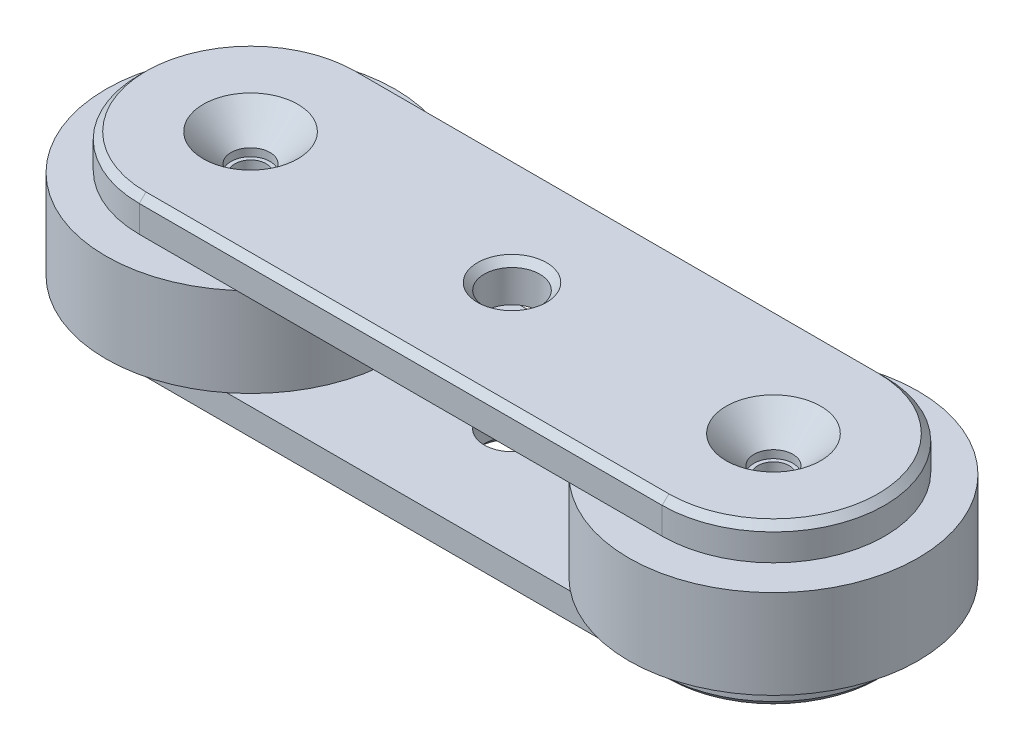
from build123d import *
from build123d.topology import SkipClean

# Parameters (mm, degrees)
SKETCH1_R            = 2.5
BOSS_EXTRUDE1_DEPTH  = 3
SKETCH10_R           = 7.5
BOSS_EXTRUDE6_DEPTH  = 0.2
SKETCH11_R           = 4.95
BOSS_EXTRUDE8_DEPTH  = 8
SKETCH12_R           = 13
SKETCH12_R_2         = 5
BOSS_EXTRUDE9_DEPTH  = 8
SKETCH13_R           = 1.4
CUT_EXTRUDE6_DEPTH   = 41.332245164
SKETCH14_R           = 2.5
SKETCH14_R_2         = 1.75
BOSS_EXTRUDE10_DEPTH = 3
BOSS_EXTRUDE11_START = 0.2
SKETCH15_R           = 7.5
SKETCH15_R_2         = 1.75
BOSS_EXTRUDE11_DEPTH = 0.2
CHAMFER1_SIZE        = 2.5
CHAMFER2_SIZE        = 0.6
BOSS_EXTRUDE12_DEPTH = 0.5
BOSS_EXTRUDE13_START = 0.5
BOSS_EXTRUDE13_DEPTH = 0.5
CHAMFER3_SIZE        = 0.6


with BuildPart() as part:
    # Sketch1 → Boss-Extrude1 (new body)
    with BuildSketch(Plane(origin=(0, 0, 0), x_dir=(1, 0, 0), z_dir=(0, 1, 0))):
        with BuildLine():
            Line((23.5, -10), (-23.5, -10))
            ThreePointArc((-23.5, -10), (-33.5, 0), (-23.5, 10))
            Line((-23.5, 10), (23.5, 10))
            ThreePointArc((23.5, 10), (33.5, 0), (23.5, -10))
        make_face()
        Circle(SKETCH1_R, mode=Mode.SUBTRACT)
    extrude(amount=BOSS_EXTRUDE1_DEPTH)

    # Sketch10 → Boss-Extrude6 (add)
    with BuildSketch(Plane(origin=(0, 3, 0), x_dir=(1, 0, 0), z_dir=(0, 1, 0))):
        with Locations((-23.5, 0)):
            Circle(SKETCH10_R)
        with Locations((23.5, 0)):
            Circle(SKETCH10_R)
    extrude(amount=BOSS_EXTRUDE6_DEPTH)

    # Sketch11 → Boss-Extrude8 (add)
    with BuildSketch(Plane(origin=(0, 3.2, 0), x_dir=(1, 0, 0), z_dir=(0, 1, 0))):
        with Locations((-23.5, 0)):
            Circle(SKETCH11_R)
        with Locations((23.5, 0)):
            Circle(SKETCH11_R)
    extrude(amount=BOSS_EXTRUDE8_DEPTH)

    # Sketch13 → Cut-Extrude6 (cut, through all)
    with BuildSketch(Plane(origin=(0, 11.2, 0), x_dir=(1, 0, 0), z_dir=(0, 1, 0))):
        with Locations((-23.5, 0)):
            Circle(SKETCH13_R)
        with Locations((23.5, 0)):
            Circle(SKETCH13_R)
    extrude(amount=-CUT_EXTRUDE6_DEPTH, mode=Mode.SUBTRACT)

    # Sketch16 → Boss-Extrude12 (add)
    with SkipClean():  # the faces are left unmerged after this step: merging them gives an invalid solid
        with BuildSketch(Plane(origin=(0, 3, 0), x_dir=(1, 0, 0), z_dir=(0, 1, 0))):
            with BuildLine():
                Line((-10, 0), (-2.5, 0))
                ThreePointArc((-2.5, 0), (0, 2.5), (2.5, 0))
                Line((2.5, 0), (10, 0))
                ThreePointArc((10, 0), (0, 10), (-10, 0))
            make_face()
        extrude(amount=BOSS_EXTRUDE12_DEPTH)

    # Chamfer3
    chamfer3_edges = [part.edges().sort_by_distance(p)[0] for p in [
        (22.1, 0, 0),
        (-2.5, 0, 0),
        (-24.9, 0, 0),
        (33.5, 0, 0),
        (0, 0, -10),
        (0, 0, 10),
        (-33.5, 0, 0),
    ]]
    chamfer(chamfer3_edges, length=CHAMFER3_SIZE)


with BuildPart() as body_2:
    # Sketch12 → Boss-Extrude9 (new body)
    with BuildSketch(Plane(origin=(0, 3.2, 0), x_dir=(1, 0, 0), z_dir=(0, 1, 0))):
        with Locations((-23.5, 0)):
            Circle(SKETCH12_R)
        with Locations((-23.5, 0)):
            Circle(SKETCH12_R_2, mode=Mode.SUBTRACT)
    extrude(amount=BOSS_EXTRUDE9_DEPTH)


with BuildPart() as body_3:
    # Mirror3: mirrored copy
    add(body_2.part.mirror(Plane(origin=(0, 0, 0), x_dir=(0, 0, 1), z_dir=(1, 0, 0))))


with BuildPart() as body_4:
    # Sketch14 → Boss-Extrude10 (new body)
    with BuildSketch(Plane(origin=(0, 11.4, 0), x_dir=(1, 0, 0), z_dir=(0, 1, 0))):
        with BuildLine():
            Line((-23.5, -10), (23.5, -10))
            ThreePointArc((23.5, -10), (33.5, 0), (23.5, 10))
            Line((23.5, 10), (-23.5, 10))
            ThreePointArc((-23.5, 10), (-33.5, 0), (-23.5, -10))
        make_face()
        Circle(SKETCH14_R, mode=Mode.SUBTRACT)
        with Locations((-23.5, 0)):
            Circle(SKETCH14_R_2, mode=Mode.SUBTRACT)
        with Locations((23.5, 0)):
            Circle(SKETCH14_R_2, mode=Mode.SUBTRACT)
    extrude(amount=BOSS_EXTRUDE10_DEPTH)

    # Sketch15 → Boss-Extrude11 (add)
    # profile 1 of 2: a face of its own
    with BuildSketch(Plane.XZ.offset(-11.4).offset(BOSS_EXTRUDE11_START)):
        with Locations((23.5, 0)):
            Circle(SKETCH15_R)
        with Locations((23.5, 0)):
            Circle(SKETCH15_R_2, mode=Mode.SUBTRACT)
    # profile 2 of 2: a face of its own
    with BuildSketch(Plane.XZ.offset(-11.4).offset(BOSS_EXTRUDE11_START)):
        with Locations((-23.5, 0)):
            Circle(SKETCH15_R)
        with Locations((-23.5, 0)):
            Circle(SKETCH15_R_2, mode=Mode.SUBTRACT)
    extrude(amount=-BOSS_EXTRUDE11_DEPTH)

    # Chamfer1
    chamfer1_edges = [body_4.edges().sort_by_distance(p)[0] for p in [
        (-25.25, 14.4, 0),
        (21.75, 14.4, 0),
    ]]
    chamfer(chamfer1_edges, length=CHAMFER1_SIZE)

    # Chamfer2
    chamfer2_edges = [body_4.edges().sort_by_distance(p)[0] for p in [
        (0, 14.4, 10),
        (33.5, 14.4, 0),
        (-33.5, 14.4, 0),
        (0, 14.4, -10),
        (-2.5, 14.4, 0),
    ]]
    chamfer(chamfer2_edges, length=CHAMFER2_SIZE)

    # Sketch17 → Boss-Extrude13 (add)
    with BuildSketch(Plane.XZ.offset(-11.4).offset(BOSS_EXTRUDE13_START)):
        with BuildLine():
            Line((-2.5, 0), (-10, 0))
            ThreePointArc((-10, 0), (0, -10), (10, 0))
            Line((10, 0), (2.5, 0))
            ThreePointArc((2.5, 0), (0, -2.5), (-2.5, 0))
        make_face()
    extrude(amount=-BOSS_EXTRUDE13_DEPTH)


solid = Compound([part.part, body_2.part, body_3.part, body_4.part])
